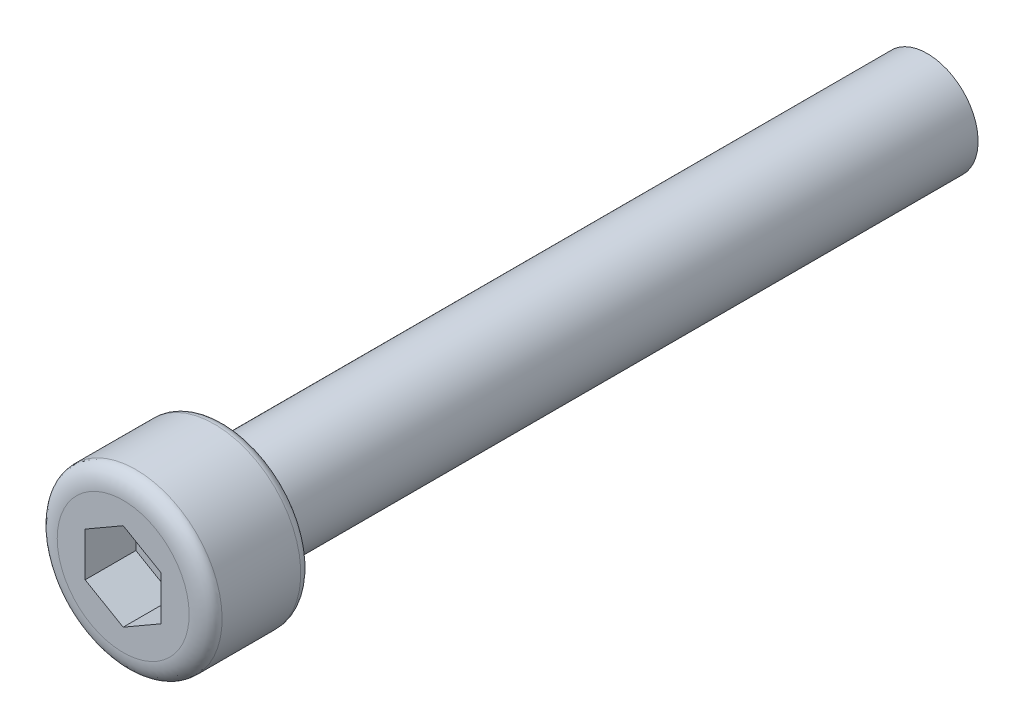
from build123d import *

# Parameters (mm, degrees)
CHAMFER_1_SIZE      = 0.3
CHAMFER_1_SIZE2     = 0.519615242
FILLET_1_R          = 0.4
FILLET_2_SIZE       = 0.5
FILLET_2_SIZE_2     = 0.8
CUT_EXTRUDE_1_DEPTH = 2


with BuildPart() as part:
    # 草图2 → 旋转1 (revolve)
    with BuildSketch(Plane(origin=(0, 0, 0), x_dir=(0, 0, -1), z_dir=(1, 0, 0)), mode=Mode.PRIVATE) as revolve_1_sk:
        Polygon((-16, 0), (-16, 3.4), (-12, 3.4), (-12, 2), (16, 2), (16, 0), align=None)
    revolve(revolve_1_sk.sketch.rotate(Axis((0, 0, -16), (0, 0, 1)), 90), axis=Axis((0, 0, -16), (0, 0, 1)))

    # 倒角1
    chamfer_1_edges = [part.edges().sort_by_distance(p)[0] for p in [
        (2, 0, -16),
    ]]
    chamfer_1_side = [part.faces().sort_by_distance(p)[0] for p in [
        (2, 0, -2),
    ]]
    chamfer(chamfer_1_edges, length=CHAMFER_1_SIZE, length2=CHAMFER_1_SIZE2, reference=chamfer_1_side[0])

    # 圆角1
    fillet_1_edges = [part.edges().sort_by_distance(p)[0] for p in [
        (3.4, 0, 12),
    ]]
    fillet(fillet_1_edges, radius=FILLET_1_R)

    # 圆角2
    # an asymmetric fillet: 0.8, 0.5 mm, written as the material it takes off along each edge
    with BuildSketch(Plane(origin=(0, 0, 16), x_dir=(-1, 0, 0), z_dir=(0, 1, 0))) as fillet_2_piece_1:
        with BuildLine():
            Bezier((3.4, -FILLET_2_SIZE), (3.4, 0), (3.4 - FILLET_2_SIZE_2, 0), weights=[1, 0.707106781, 1])
            Line((3.4 - FILLET_2_SIZE_2, 0), (3.4, 0))
            Line((3.4, 0), (3.4, -FILLET_2_SIZE))
        make_face()
    revolve(axis=Axis((0, 0, 16), (0, 0, 1)), mode=Mode.SUBTRACT)

    # 草图3 → 切除-拉伸1 (cut)
    with BuildSketch(Plane.XY.offset(16)):
        Polygon((0, 1.732050808), (-1.5, 0.866025404), (-1.5, -0.866025404), (0, -1.732050808), (1.5, -0.866025404), (1.5, 0.866025404), align=None)
    extrude(amount=-CUT_EXTRUDE_1_DEPTH, mode=Mode.SUBTRACT)


solid = part.part
